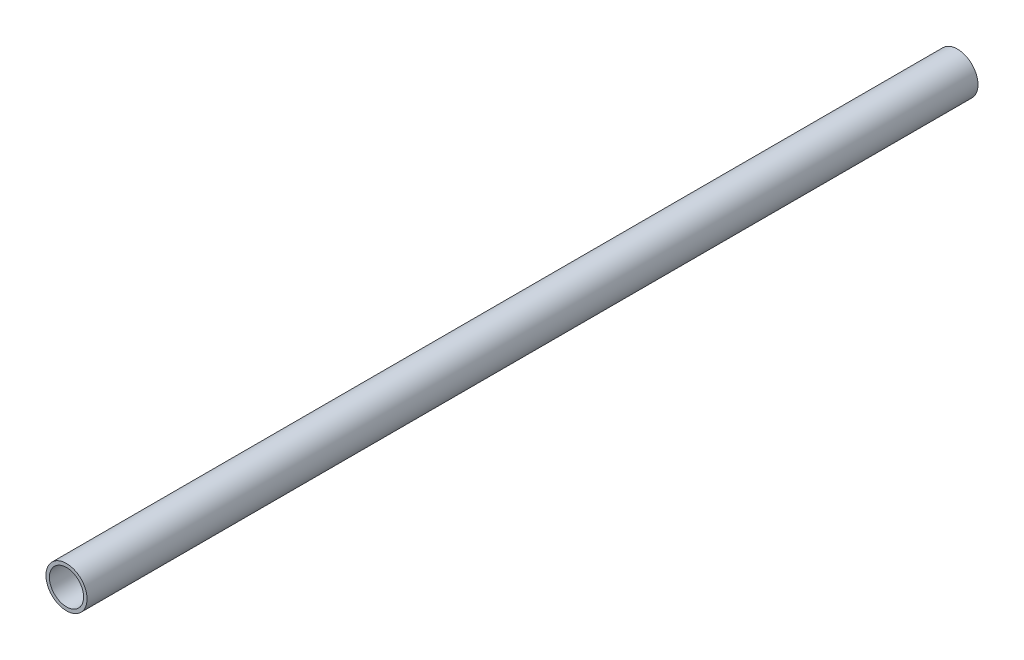
from build123d import *

# Parameters (mm, degrees)
SKETCH1_R           = 21.082
SKETCH1_R_2         = 17.526
EXTRUDE_THIN1_DEPTH = 457.2


with BuildPart() as part:
    # Sketch1 → Extrude-Thin1 (new, symmetric)
    with BuildSketch(Plane.XY):
        Circle(SKETCH1_R)
        Circle(SKETCH1_R_2, mode=Mode.SUBTRACT)
    extrude(amount=EXTRUDE_THIN1_DEPTH, both=True)


solid = part.part
